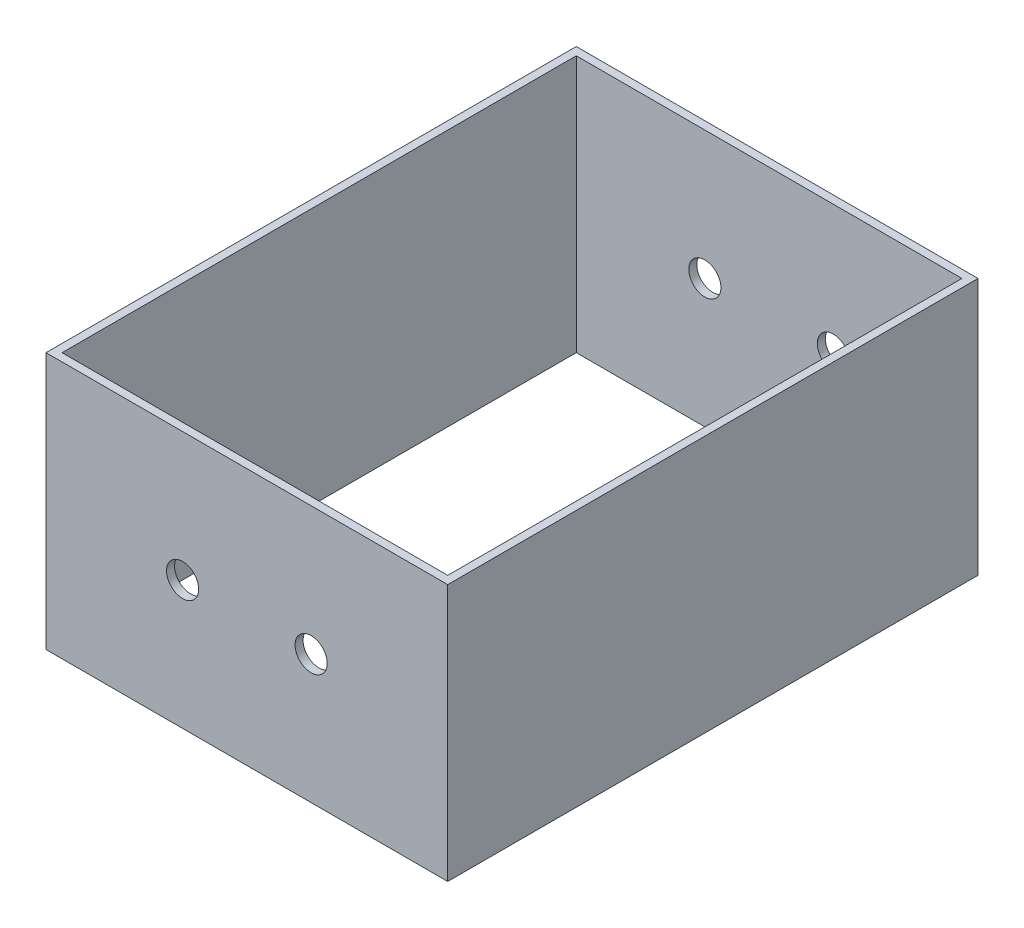
from build123d import *

# Parameters (mm, degrees)
SKETCH1_W               = 152.4
SKETCH1_H               = 203.2
BOSS_EXTRUDE1_DEPTH     = 101.6
SHELL1_T                = 3.175
CUT_EXTRUDE1_DEPTH      = 247.036893829
CUT_EXTRUDE1_DEPTH_BACK = 247.036893829
SKETCH2_R               = 6.35


with BuildPart() as part:
    # Sketch1 → Boss-Extrude1 (new body)
    with BuildSketch(Plane(origin=(0, 0, 0), x_dir=(1, 0, 0), z_dir=(0, 1, 0))):
        Rectangle(SKETCH1_W, SKETCH1_H)
    extrude(amount=BOSS_EXTRUDE1_DEPTH)

    # Shell1
    shell1_openings = [part.faces().sort_by_distance(p)[0] for p in [
        (0, 0, 0),
        (0, 101.6, 0),
    ]]
    offset(amount=SHELL1_T, openings=shell1_openings, kind=Kind.INTERSECTION)

    # Sketch2 → Cut-Extrude1 (cut, two sides: drawn at the far end of the back side and taken through both)
    with BuildSketch(Plane.XY.offset(104.775).offset(-CUT_EXTRUDE1_DEPTH_BACK)):
        with Locations((-25.4, 50.8)):
            Circle(SKETCH2_R)
        with Locations((25.4, 50.8)):
            Circle(SKETCH2_R)
    extrude(amount=CUT_EXTRUDE1_DEPTH + CUT_EXTRUDE1_DEPTH_BACK, mode=Mode.SUBTRACT)


solid = part.part
